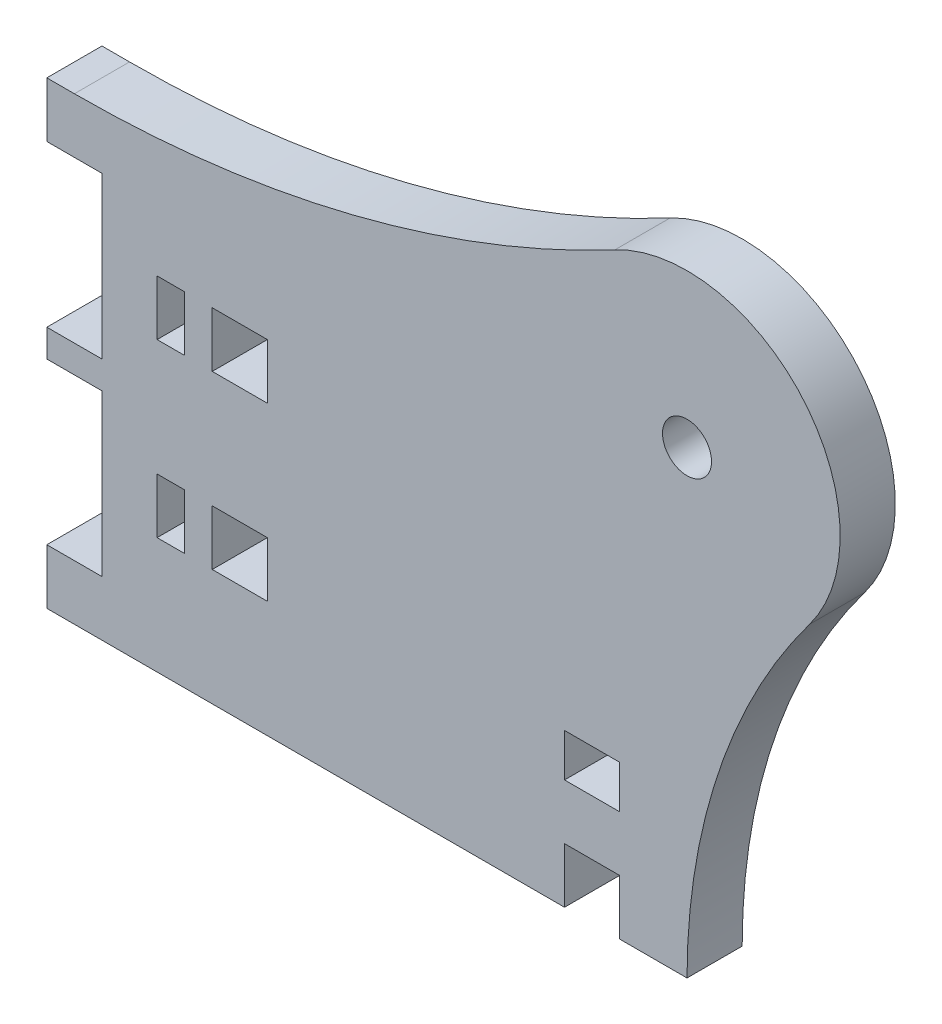
from build123d import *

# Parameters (mm, degrees)
SKETCH1_R                = 8
SKETCH1_R_2              = 4
BOSS_EXTRUDE1_DEPTH      = 9
BOSS_EXTRUDE1_2_DEPTH    = 9
SKETCH2_R                = 4
BOSS_EXTRUDE3_DEPTH      = 9
FILLET1_R                = 1
CUT_EXTRUDE1_DEPTH       = 214.789616212
SKETCH4_W                = 9
SKETCH4_H                = 27
BOSS_EXTRUDE4_DEPTH      = 75
BOSS_EXTRUDE5_START      = 9
SKETCH5_R                = 25
SKETCH5_R_2              = 4
BOSS_EXTRUDE5_DEPTH      = 9
BOSS_EXTRUDE6_DEPTH      = 4.5
BOSS_EXTRUDE6_DEPTH_BACK = 4.5
BOSS_EXTRUDE7_DEPTH      = 4.5
BOSS_EXTRUDE7_DEPTH_BACK = 4.5
BOSS_EXTRUDE7_START      = -25
SKETCH9_W                = 9
SKETCH9_H                = 7
SKETCH9_H_2              = 9
CUT_EXTRUDE2_DEPTH       = 217.612557346
CUT_EXTRUDE3_DEPTH       = 216.299790989
CUT_EXTRUDE3_DEPTH_BACK  = 216.299790989
CAVITY1_START            = -66
CAVITY1_OUTLINE_W        = 9
CAVITY1_OUTLINE_H        = 9
CAVITY1_DEPTH            = 26.25
CAVITY1_START_2          = -35.25
CAVITY1_2_OUTLINE_W      = 9
CAVITY1_2_OUTLINE_H      = 9
CAVITY1_2_DEPTH          = 26.25
CAVITY1_START_3          = -56
CAVITY1_3_OUTLINE_W      = 9
CAVITY1_3_OUTLINE_H      = 9
CAVITY1_3_OUTLINE_W_2    = 4.5
CAVITY1_3_DEPTH          = 9
CAVITY1_START_4          = -28
CAVITY1_4_OUTLINE_W      = 9
CAVITY1_4_OUTLINE_H      = 9
CAVITY1_4_OUTLINE_W_2    = 4.5
CAVITY1_4_DEPTH          = 9


# Read off the part's stored shape, not the designer's step: Cavity1
with BuildPart() as part:
    # Sketch1 → Boss-Extrude1 (new body)
    with BuildSketch(Plane.XY):
        with Locations((-125, 0)):
            Circle(SKETCH1_R)
        with Locations((-125, 0)):
            Circle(SKETCH1_R_2, mode=Mode.SUBTRACT)
    extrude(amount=BOSS_EXTRUDE1_DEPTH)



with BuildPart() as body_2:
    # Sketch1 → Boss-Extrude1 2 (new body)
    with BuildSketch(Plane.XY):
        with Locations((125, 0)):
            Circle(SKETCH1_R)
        with Locations((125, 0)):
            Circle(SKETCH1_R_2, mode=Mode.SUBTRACT)
    extrude(amount=BOSS_EXTRUDE1_2_DEPTH)


with BuildPart() as part_1:
    add(part.part)

    add(body_2.part)  # Boss-Extrude3 merges body 2
    # Sketch2 → Boss-Extrude3 (add)
    with BuildSketch(Plane.XY):
        with BuildLine():
            Line((-175, -75), (125, -75))
            ThreePointArc((125, -75), (130.131670325, -43.377223009), (145.000000492, -14.999999344))
            ThreePointArc((145.000000492, -14.999999344), (143.981414944, 16.269784471), (113.235294528, 22.058823748))
            ThreePointArc((113.235294528, 22.058823748), (25.000000075, 0), (-63.235294395, 22.058823677))
            ThreePointArc((-63.235294395, 22.058823677), (-75.420498385, 24.996463372), (-87.499999896, 21.650635154))
            ThreePointArc((-87.499999896, 21.650635154), (-99.999999954, 18.301270189), (-112.500000024, 21.650635108))
            ThreePointArc((-112.500000024, 21.650635108), (-124.99999995, 25), (-137.49999989, 21.650635158))
            ThreePointArc((-137.49999989, 21.650635158), (-149.999999954, 18.301270189), (-162.50000003, 21.650635112))
            ThreePointArc((-162.50000003, 21.650635112), (-193.705072901, 16.586749162), (-195.000000551, -14.999999265))
            ThreePointArc((-195.000000551, -14.999999265), (-180.13167034, -43.377222962), (-175, -75))
        make_face()
        with Locations((125, 0)):
            Circle(SKETCH2_R, mode=Mode.SUBTRACT)
        with Locations((-175, 0)):
            Circle(SKETCH2_R, mode=Mode.SUBTRACT)
        with Locations((-125, 0)):
            Circle(SKETCH2_R, mode=Mode.SUBTRACT)
        with Locations((-75, 0)):
            Circle(SKETCH2_R, mode=Mode.SUBTRACT)
    extrude(amount=BOSS_EXTRUDE3_DEPTH)

    # Fillet1
    fillet1_edges = [part_1.edges().sort_by_distance(p)[0] for p in [
        (-175, -75, 4.5),
        (125, -75, 4.5),
    ]]
    fillet(fillet1_edges, radius=FILLET1_R)

    # Sketch3 → Cut-Extrude1 (cut, through all)
    with BuildSketch(Plane.XY):
        Polygon((25, 0), (25, -75), (150, -75), (150, 25), (25, 25), align=None)
    extrude(amount=CUT_EXTRUDE1_DEPTH, mode=Mode.SUBTRACT)

    # Sketch4 → Boss-Extrude4 (add)
    with BuildSketch(Plane.XZ.offset(75)):
        with Locations((25, -4.5)):
            Rectangle(SKETCH4_W, SKETCH4_H)
    extrude(amount=-BOSS_EXTRUDE4_DEPTH)

    # Sketch5 → Boss-Extrude5 (add)
    # profile 1 of 4: a face of its own
    with BuildSketch(Plane(origin=(0, 0, -18), x_dir=(-1, 0, 0), z_dir=(0, 0, -1)).offset(BOSS_EXTRUDE5_START)):
        with BuildLine():
            ThreePointArc((-145.000000304, -14.999999594), (-130.131670275, -43.377223158), (-125, -75))
            Line((-125, -75), (-29.5, -75))
            Line((-29.5, -75), (-29.5, 0))
            Line((-29.5, 0), (-100, 0))
            ThreePointArc((-100, 0), (-117.09430609, -23.717082532), (-145.000000304, -14.999999594))
        make_face()
    # profile 2 of 4: a face of its own
    with BuildSketch(Plane(origin=(0, 0, -18), x_dir=(-1, 0, 0), z_dir=(0, 0, -1)).offset(BOSS_EXTRUDE5_START)):
        with Locations((-125, 0)):
            Circle(SKETCH5_R)
        with Locations((-125, 0)):
            Circle(SKETCH5_R_2, mode=Mode.SUBTRACT)
    # profile 3 of 4: a face of its own
    with BuildSketch(Plane(origin=(0, 0, -18), x_dir=(-1, 0, 0), z_dir=(0, 0, -1)).offset(BOSS_EXTRUDE5_START)):
        Polygon((-29.5, 0), (-29.5, -75), (-20.5, -75), (-20.5, 0), (-25, 0), align=None)
    # profile 4 of 4: a face of its own
    with BuildSketch(Plane(origin=(0, 0, -18), x_dir=(-1, 0, 0), z_dir=(0, 0, -1)).offset(BOSS_EXTRUDE5_START)):
        with BuildLine():
            Line((-100, 0), (-29.5, 0))
            Line((-29.5, 0), (-25, 0))
            ThreePointArc((-25, 0), (-70.475429529, 5.598281181), (-113.235293817, 22.058823369))
            ThreePointArc((-113.235293817, 22.058823369), (-103.56267677, 12.86239374), (-100, 0))
        make_face()
    extrude(amount=-BOSS_EXTRUDE5_DEPTH)

    # Sketch7 → Boss-Extrude6 (add, two sides: drawn at the far end of the back side and taken through both)
    with BuildSketch(Plane(origin=(0, -25, 0), x_dir=(1, 0, 0), z_dir=(0, 1, 0)).offset(-BOSS_EXTRUDE6_DEPTH_BACK)):
        with BuildLine():
            Line((56.5, 18), (29.5, 18))
            Line((29.5, 18), (29.5, -9))
            ThreePointArc((29.5, -9), (48.591883092, -1.091883092), (56.5, 18))
        make_face()
        with BuildLine():
            Line((-6.5, 0), (20.5, 0))
            Line((20.5, 0), (20.5, 27))
            ThreePointArc((20.5, 27), (1.408116908, 19.091883092), (-6.5, 0))
        make_face()
    extrude(amount=BOSS_EXTRUDE6_DEPTH + BOSS_EXTRUDE6_DEPTH_BACK)

    # Sketch7<3> → Boss-Extrude7 (add, two sides: drawn at the far end of the back side and taken through both)
    with BuildSketch(Plane(origin=(0, -25, 0), x_dir=(1, 0, 0), z_dir=(0, 1, 0)).offset(BOSS_EXTRUDE7_START - BOSS_EXTRUDE7_DEPTH_BACK)):
        with BuildLine():
            Line((56.5, 18), (29.5, 18))
            Line((29.5, 18), (29.5, -9))
            ThreePointArc((29.5, -9), (48.591883092, -1.091883092), (56.5, 18))
        make_face()
        with BuildLine():
            Line((-6.5, 0), (20.5, 0))
            Line((20.5, 0), (20.5, 27))
            ThreePointArc((20.5, 27), (1.408116908, 19.091883092), (-6.5, 0))
        make_face()
    extrude(amount=BOSS_EXTRUDE7_DEPTH + BOSS_EXTRUDE7_DEPTH_BACK)

    # Sketch9 → Cut-Extrude2 (cut, through all)
    with BuildSketch(Plane.XY.offset(9)):
        with Locations((-160.208548161, -53.5)):
            Rectangle(SKETCH9_W, SKETCH9_H)
        with Locations((-160.208548161, -70.5)):
            Rectangle(SKETCH9_W, SKETCH9_H_2)
        with Locations((-25.351798772, -53.5)):
            Rectangle(SKETCH9_W, SKETCH9_H)
        with Locations((-25.351798772, -70.5)):
            Rectangle(SKETCH9_W, SKETCH9_H_2)
        with Locations((109.504950616, -53.5)):
            Rectangle(SKETCH9_W, SKETCH9_H)
        with Locations((109.504950616, -70.5)):
            Rectangle(SKETCH9_W, SKETCH9_H_2)
    extrude(amount=-CUT_EXTRUDE2_DEPTH, mode=Mode.SUBTRACT)

    # Sketch10 → Cut-Extrude3 (cut, two sides: drawn at the far end of the back side and taken through both)
    with BuildSketch(Plane(origin=(0, 0, 0), x_dir=(1, 0, 0), z_dir=(0, 1, 0)).offset(-CUT_EXTRUDE3_DEPTH_BACK)):
        Polygon((-200, 27), (-200, 0), (25, 0), (25, -9), (150, -9), (150, 18), (20.5, 18), (20.5, 27), align=None)
    extrude(amount=CUT_EXTRUDE3_DEPTH + CUT_EXTRUDE3_DEPTH_BACK, mode=Mode.SUBTRACT)


with BuildPart() as cut_extrude3_kept_piece:
    # of the separate pieces the step leaves, the one the design keeps (cut_extrude3_pieces_kept)
    add(part_1.part.solids().sort_by_distance((20.5, 0, -27))[0])

    # Cavity1 outline → Cavity1 (cut)
    with BuildSketch(Plane(origin=(0, 0, 0), x_dir=(1, 0, 0), z_dir=(0, 1, 0)).offset(CAVITY1_START)):
        with Locations((25, 22.5)):
            Rectangle(CAVITY1_OUTLINE_W, CAVITY1_OUTLINE_H)
    extrude(amount=CAVITY1_DEPTH, mode=Mode.SUBTRACT)

    # Cavity1 2 outline → Cavity1 2 (cut)
    with BuildSketch(Plane(origin=(0, 0, 0), x_dir=(1, 0, 0), z_dir=(0, 1, 0)).offset(CAVITY1_START_2)):
        with Locations((25, 22.5)):
            Rectangle(CAVITY1_2_OUTLINE_W, CAVITY1_2_OUTLINE_H)
    extrude(amount=CAVITY1_2_DEPTH, mode=Mode.SUBTRACT)

    # Cavity1 3 outline → Cavity1 3 (cut)
    with BuildSketch(Plane(origin=(0, 0, 0), x_dir=(1, 0, 0), z_dir=(0, 1, 0)).offset(CAVITY1_START_3)):
        with Locations((52, 22.5)):
            Rectangle(CAVITY1_3_OUTLINE_W, CAVITY1_3_OUTLINE_H)
        with Locations((40.75, 22.5)):
            Rectangle(CAVITY1_3_OUTLINE_W_2, CAVITY1_3_OUTLINE_H)
    extrude(amount=CAVITY1_3_DEPTH, mode=Mode.SUBTRACT)

    # Cavity1 4 outline → Cavity1 4 (cut)
    with BuildSketch(Plane(origin=(0, 0, 0), x_dir=(1, 0, 0), z_dir=(0, 1, 0)).offset(CAVITY1_START_4)):
        with Locations((52, 22.5)):
            Rectangle(CAVITY1_4_OUTLINE_W, CAVITY1_4_OUTLINE_H)
        with Locations((40.75, 22.5)):
            Rectangle(CAVITY1_4_OUTLINE_W_2, CAVITY1_4_OUTLINE_H)
    extrude(amount=CAVITY1_4_DEPTH, mode=Mode.SUBTRACT)


solid = cut_extrude3_kept_piece.part
